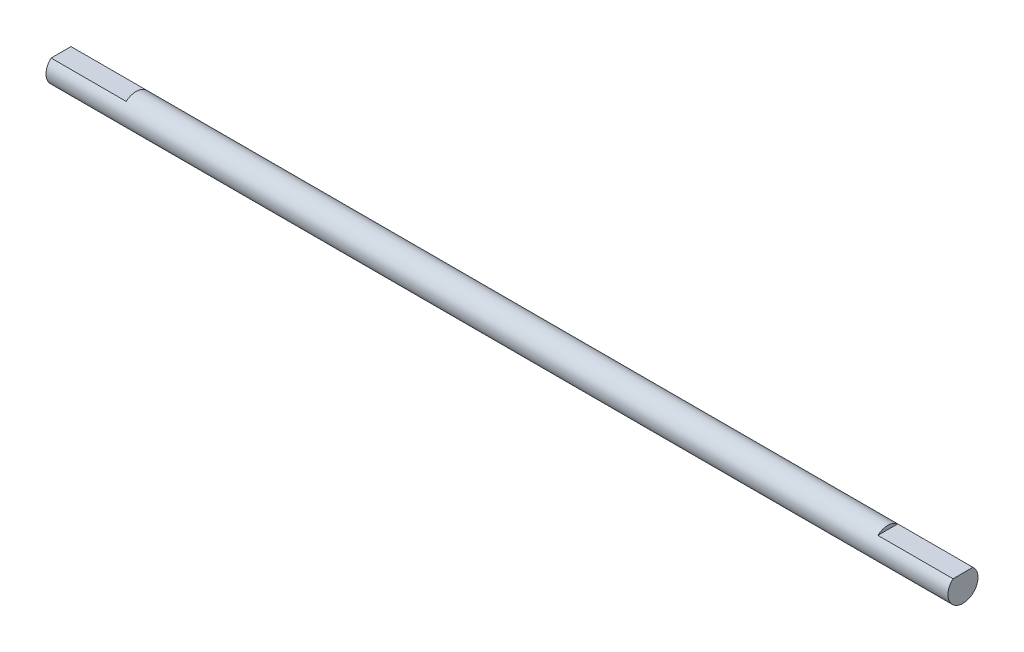
from build123d import *

# Parameters (mm, degrees)
BOSS_EXTRUDE1_DEPTH = 60
SKETCH2_R           = 2
BOSS_EXTRUDE2_DEPTH = 50


with BuildPart() as part:
    # Sketch1 → Boss-Extrude1 (new, symmetric)
    with BuildSketch(Plane(origin=(0, 0, 0), x_dir=(0, 0, -1), z_dir=(1, 0, 0))):
        with BuildLine():
            Line((-1.322875656, 1.5), (1.322875656, 1.5))
            ThreePointArc((1.322875656, 1.5), (0, -2), (-1.322875656, 1.5))
        make_face()
    extrude(amount=BOSS_EXTRUDE1_DEPTH, both=True)

    # Sketch2 → Boss-Extrude2 (add, symmetric)
    with BuildSketch(Plane(origin=(0, 0, 0), x_dir=(0, 0, -1), z_dir=(1, 0, 0))):
        Circle(SKETCH2_R)
    extrude(amount=BOSS_EXTRUDE2_DEPTH, both=True)


solid = part.part
